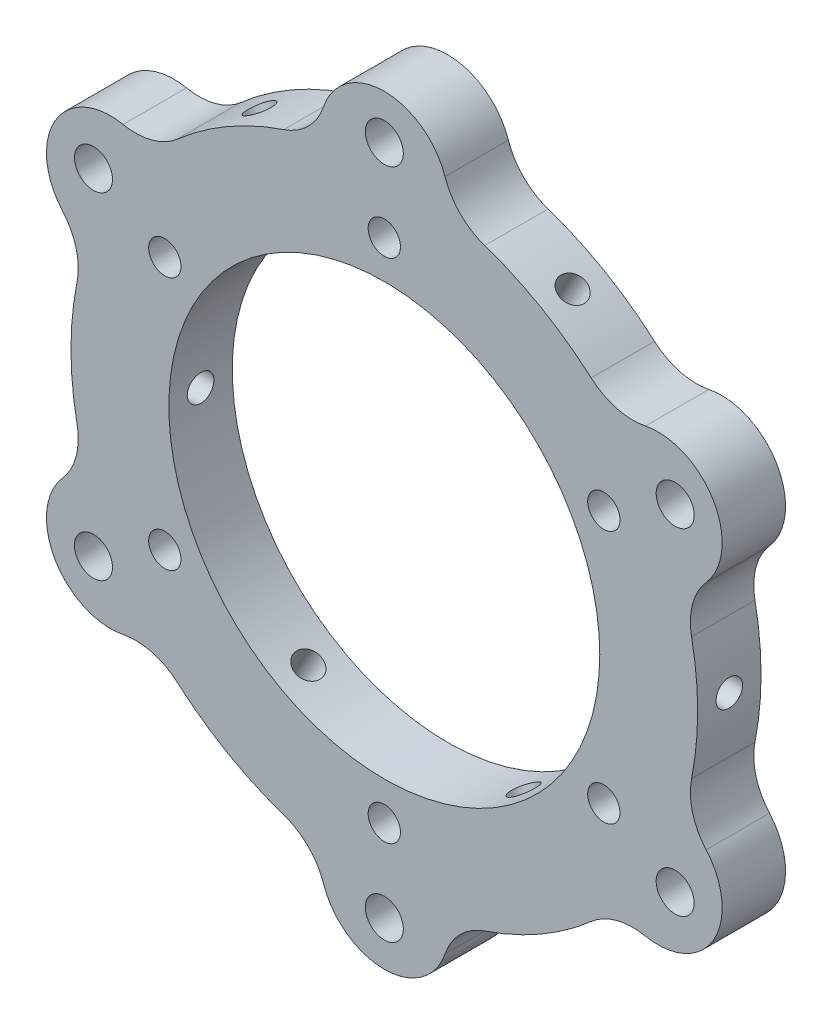
from build123d import *

# Parameters (mm, degrees)
SKETCH2_R           = 3
SKETCH2_R_2         = 2.55
SKETCH2_R_3         = 34
BOSS_EXTRUDE1_DEPTH = 10
SKETCH4_R           = 2.1
CUT_EXTRUDE1_DEPTH  = 81.886030793
CIRPATTERN1_COUNT   = 6


with BuildPart() as part:
    # Sketch2 → Boss-Extrude1 (new body)
    with BuildSketch(Plane.XY):
        with BuildLine():
            ThreePointArc((50.792573497, 18.265840665), (51.961524227, 30), (41.214968786, 34.85473864))
            ThreePointArc((41.214968786, 34.85473864), (36.65999643, 34.997336465), (32.641290086, 37.146314508))
            ThreePointArc((32.641290086, 37.146314508), (24.725, 42.824956217), (15.849006977, 46.841343681))
            ThreePointArc((15.849006977, 46.841343681), (11.978584229, 49.247156444), (9.577604711, 53.120579305))
            ThreePointArc((9.577604711, 53.120579305), (0, 60), (-9.577604711, 53.120579305))
            ThreePointArc((-9.577604711, 53.120579305), (-11.978584229, 49.247156444), (-15.849006977, 46.841343681))
            ThreePointArc((-15.849006977, 46.841343681), (-24.725, 42.824956217), (-32.641290086, 37.146314508))
            ThreePointArc((-32.641290086, 37.146314508), (-36.65999643, 34.997336465), (-41.214968786, 34.85473864))
            ThreePointArc((-41.214968786, 34.85473864), (-51.961524227, 30), (-50.792573497, 18.265840665))
            ThreePointArc((-50.792573497, 18.265840665), (-48.638580659, 14.249819979), (-48.490297064, 9.695029173))
            ThreePointArc((-48.490297064, 9.695029173), (-49.45, 0), (-48.490297064, -9.695029173))
            ThreePointArc((-48.490297064, -9.695029173), (-48.638580659, -14.249819979), (-50.792573497, -18.265840665))
            ThreePointArc((-50.792573497, -18.265840665), (-51.961524227, -30), (-41.214968786, -34.85473864))
            ThreePointArc((-41.214968786, -34.85473864), (-36.65999643, -34.997336465), (-32.641290086, -37.146314508))
            ThreePointArc((-32.641290086, -37.146314508), (-24.725, -42.824956217), (-15.849006977, -46.841343681))
            ThreePointArc((-15.849006977, -46.841343681), (-11.978584229, -49.247156444), (-9.577604711, -53.120579305))
            ThreePointArc((-9.577604711, -53.120579305), (0, -60), (9.577604711, -53.120579305))
            ThreePointArc((9.577604711, -53.120579305), (11.978584229, -49.247156444), (15.849006977, -46.841343681))
            ThreePointArc((15.849006977, -46.841343681), (24.725, -42.824956217), (32.641290086, -37.146314508))
            ThreePointArc((32.641290086, -37.146314508), (36.65999643, -34.997336465), (41.214968786, -34.85473864))
            ThreePointArc((41.214968786, -34.85473864), (51.961524227, -30), (50.792573497, -18.265840665))
            ThreePointArc((50.792573497, -18.265840665), (48.638580659, -14.249819979), (48.490297064, -9.695029173))
            ThreePointArc((48.490297064, -9.695029173), (49.45, 0), (48.490297064, 9.695029173))
            ThreePointArc((48.490297064, 9.695029173), (48.638580659, 14.249819979), (50.792573497, 18.265840665))
        make_face()
        with Locations((45.899346401, 26.5)):
            Circle(SKETCH2_R, mode=Mode.SUBTRACT)
        with Locations((0, 53)):
            Circle(SKETCH2_R, mode=Mode.SUBTRACT)
        with Locations((-34.641016151, -20)):
            Circle(SKETCH2_R_2, mode=Mode.SUBTRACT)
        with Locations((0, -40)):
            Circle(SKETCH2_R_2, mode=Mode.SUBTRACT)
        with Locations((34.641016151, -20)):
            Circle(SKETCH2_R_2, mode=Mode.SUBTRACT)
        with Locations((-34.641016151, 20)):
            Circle(SKETCH2_R_2, mode=Mode.SUBTRACT)
        with Locations((0, 40)):
            Circle(SKETCH2_R_2, mode=Mode.SUBTRACT)
        Circle(SKETCH2_R_3, mode=Mode.SUBTRACT)
        with Locations((34.641016151, 20)):
            Circle(SKETCH2_R_2, mode=Mode.SUBTRACT)
        with Locations((45.899346401, -26.5)):
            Circle(SKETCH2_R, mode=Mode.SUBTRACT)
        with Locations((0, -53)):
            Circle(SKETCH2_R, mode=Mode.SUBTRACT)
        with Locations((-45.899346401, -26.5)):
            Circle(SKETCH2_R, mode=Mode.SUBTRACT)
        with Locations((-45.899346401, 26.5)):
            Circle(SKETCH2_R, mode=Mode.SUBTRACT)
    extrude(amount=BOSS_EXTRUDE1_DEPTH)

    # Sketch4 → Cut-Extrude1 (cut, symmetric)
    with BuildSketch(Plane(origin=(0, 0, 0), x_dir=(0, 0, -1), z_dir=(-0.500000000000001, 0.866025403784438, 0))):
        with Locations((-5, 0)):
            Circle(SKETCH4_R)
    cut_extrude1 = extrude(amount=CUT_EXTRUDE1_DEPTH, both=True, mode=Mode.SUBTRACT)

    # CirPattern1: Cut-Extrude1 ×6 about axis
    cirpattern1_axis = Axis((0, 0, 16.500840286), (0, 0, -1))
    for i in range(1, CIRPATTERN1_COUNT):
        add(cut_extrude1.rotate(cirpattern1_axis, i * 360 / CIRPATTERN1_COUNT), mode=Mode.SUBTRACT)


solid = part.part
